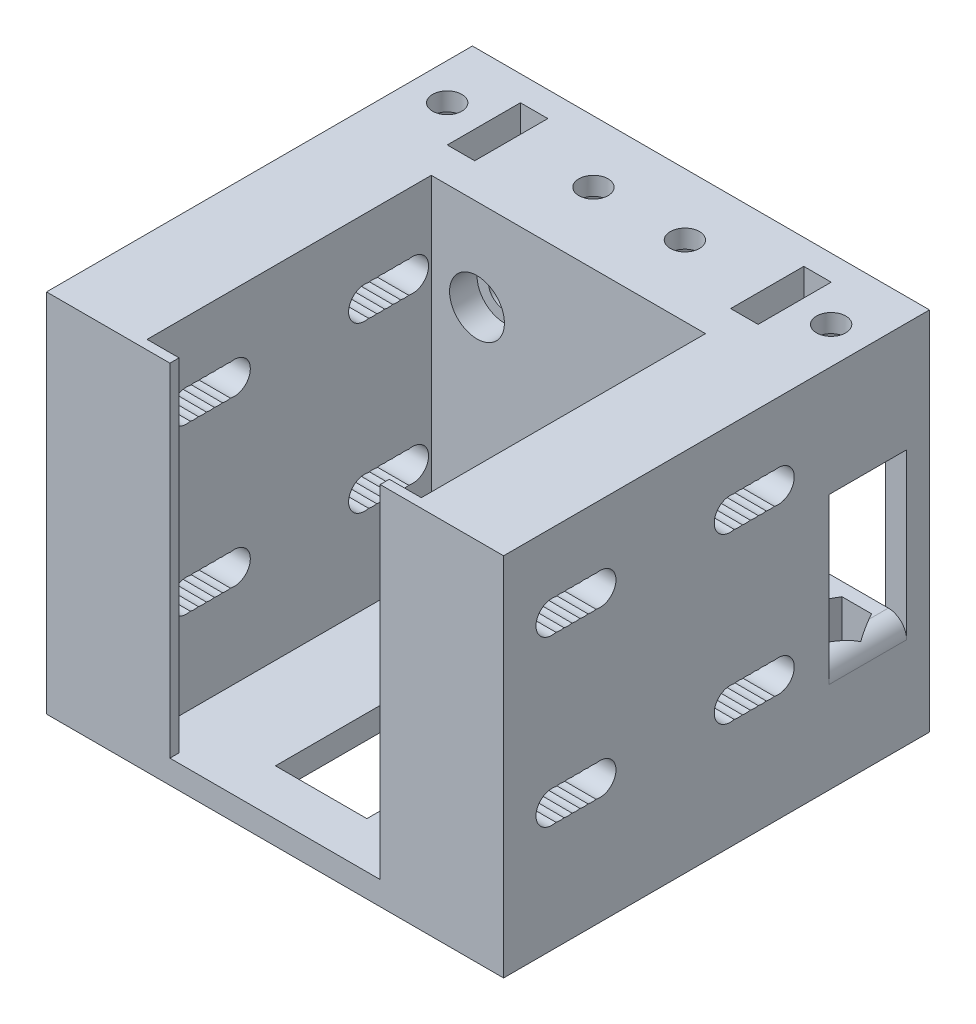
from build123d import *

# Parameters (mm, degrees)
SKETCH1_W                    = 50
SKETCH1_H                    = 15
MAIN_BODY_DEPTH              = 40
SKETCH2_W                    = 50
SKETCH2_H                    = 40
SKETCH2_W_2                  = 45.4
SKETCH2_H_2                  = 27.4
CARRAIGE_MOUNT_DEPTH         = 2.5
SKETCH3_R                    = 1.75
CARRAIGE_SCREW_HOLES_DEPTH   = 15
LA_CUTOUT_DEPTH              = 28.09
FRONT_WALL_DEPTH             = 1
SKETCH9_W                    = 10
SKETCH9_H                    = 20
LA_THROUGH_HOLE_DEPTH        = 3
SKETCH10_W                   = 8.5
SKETCH10_H                   = 16
BELT_HOLE_DEPTH              = 50
SKETCH14_R                   = 3
CARRAIGE_SCREW_HEADS_DEPTH   = 6
SKETCH15_W                   = 3
SKETCH15_H                   = 8
LEFT_BELT_SLOT_DEPTH         = 14
SKETCH19_R                   = 1.6
BELT_MOUNT_SCREW_HOLES_DEPTH = 14
BELT_MOUNT_NUT_HOLES_START   = -10
BELT_MOUNT_NUT_HOLES_DEPTH   = 40
FILLET1_R                    = 2
LA_SCREW_HOLES_START         = -10
SKETCH8_R                    = 1.75
LA_SCREW_HOLES_DEPTH         = 50
SKETCH21_W                   = 30
SKETCH21_H                   = 37.423299635
CUT_EXTRUDE1_DEPTH           = 3
LPATTERN1_COUNT              = 7
LPATTERN1_PITCH              = 0.875


with BuildPart() as part:
    # Sketch1 → Main_Body (new body)
    with BuildSketch(Plane(origin=(0, 0, 0), x_dir=(1, 0, 0), z_dir=(0, 1, 0))):
        with Locations((25, 7.5)):
            Rectangle(SKETCH1_W, SKETCH1_H)
    extrude(amount=MAIN_BODY_DEPTH)

    # Sketch2 → Carraige_Mount (add)
    with BuildSketch(Plane(origin=(0, 0, -15), x_dir=(-1, 0, 0), z_dir=(0, 0, -1))):
        with Locations((-25, 20)):
            Rectangle(SKETCH2_W, SKETCH2_H)
        with Locations((-25, 20)):
            Rectangle(SKETCH2_W_2, SKETCH2_H_2, mode=Mode.SUBTRACT)
    extrude(amount=CARRAIGE_MOUNT_DEPTH)

    # Sketch3 → Carraige_Screw_Holes (cut)
    with BuildSketch(Plane.XY):
        with Locations((15, 30)):
            Circle(SKETCH3_R)
        with Locations((35, 30)):
            Circle(SKETCH3_R)
        with Locations((35, 10)):
            Circle(SKETCH3_R)
        with Locations((15, 10)):
            Circle(SKETCH3_R)
    extrude(amount=-CARRAIGE_SCREW_HOLES_DEPTH, mode=Mode.SUBTRACT)

    # Sketch6 → LA_Cutout (add)
    with BuildSketch(Plane.XY):
        Polygon((0, 40), (0, 0), (50, 0), (50, 40), (40, 40), (40, 2.576700365), (10, 2.576700365), (10, 40), align=None)
    extrude(amount=LA_CUTOUT_DEPTH)

    # Sketch7 → Front_Wall (add)
    with BuildSketch(Plane.XY.offset(28.09)):
        Polygon((0, 40), (0, 0), (50, 0), (50, 40), (36.5, 40), (36.5, 2.576700365), (13.5, 2.576700365), (13.5, 40), align=None)
    extrude(amount=FRONT_WALL_DEPTH)

    # Sketch9 → LA_Through_Hole (cut)
    with BuildSketch(Plane(origin=(0, 2.576700365, 0), x_dir=(1, 0, 0), z_dir=(0, 1, 0))):
        with Locations((25, -14.045)):
            Rectangle(SKETCH9_W, SKETCH9_H)
    extrude(amount=-LA_THROUGH_HOLE_DEPTH, mode=Mode.SUBTRACT)

    # Sketch10 → Belt_Hole (cut)
    with BuildSketch(Plane.ZY):
        with Locations((-10.75, 20)):
            Rectangle(SKETCH10_W, SKETCH10_H)
    extrude(amount=-BELT_HOLE_DEPTH, mode=Mode.SUBTRACT)

    # Sketch14 → Carraige_Screw_Heads (cut)
    with BuildSketch(Plane.XY):
        with Locations((15, 30)):
            Circle(SKETCH14_R)
        with Locations((35, 30)):
            Circle(SKETCH14_R)
        with Locations((35, 10)):
            Circle(SKETCH14_R)
        with Locations((15, 10)):
            Circle(SKETCH14_R)
    extrude(amount=-CARRAIGE_SCREW_HEADS_DEPTH, mode=Mode.SUBTRACT)

    # Sketch15 → Left_Belt_Slot (cut)
    with BuildSketch(Plane(origin=(0, 40, 0), x_dir=(1, 0, 0), z_dir=(0, 1, 0))):
        with Locations((9.5, 10.75)):
            Rectangle(SKETCH15_W, SKETCH15_H)
    left_belt_slot = extrude(amount=-LEFT_BELT_SLOT_DEPTH, mode=Mode.SUBTRACT)

    # Sketch19 → Belt_Mount_Screw_Holes (cut)
    with BuildSketch(Plane(origin=(0, 40, 0), x_dir=(1, 0, 0), z_dir=(0, 1, 0))):
        with Locations(Location((4, 10.742261619, 0), (0, 0, 270))):
            Circle(SKETCH19_R)
        with Locations(Location((20, 10.742261619, 0), (0, 0, 270))):
            Circle(SKETCH19_R)
    belt_mount_screw_holes = extrude(amount=-BELT_MOUNT_SCREW_HOLES_DEPTH, mode=Mode.SUBTRACT)

    # Sketch20 → Belt_Mount_Nut_Holes (cut)
    with BuildSketch(Plane.XZ.offset(-28).offset(BELT_MOUNT_NUT_HOLES_START)):
        Polygon((18.383419246, -13.542261619), (21.616580754, -13.542261619), (23.233161507, -10.742261619), (21.616580754, -7.942261619), (18.383419246, -7.942261619), (16.766838493, -10.742261619), align=None)
        Polygon((7.233161507, -10.742261619), (5.616580754, -7.942261619), (2.383419246, -7.942261619), (0.766838493, -10.742261619), (2.383419246, -13.542261619), (5.616580754, -13.542261619), align=None)
    belt_mount_nut_holes = extrude(amount=BELT_MOUNT_NUT_HOLES_DEPTH, mode=Mode.SUBTRACT)

    # Belt_Mount_Mirror: Left_Belt_Slot, Belt_Mount_Screw_Holes, Belt_Mount_Nut_Holes across plane
    add(left_belt_slot.mirror(Plane.ZY.offset(-25)), mode=Mode.SUBTRACT)
    add(belt_mount_screw_holes.mirror(Plane.ZY.offset(-25)), mode=Mode.SUBTRACT)
    add(belt_mount_nut_holes.mirror(Plane.ZY.offset(-25)), mode=Mode.SUBTRACT)

    # Fillet1
    # the kernel refuses this fillet: 2 mm, written as the material it takes off along each edge
    with BuildSketch(Plane(origin=(50, 12, -15), x_dir=(0, -1, 0), z_dir=(0, 0, 1))) as fillet1_piece_1:
        with BuildLine():
            CenterArc((FILLET1_R, -FILLET1_R), FILLET1_R, 90, 90)
            Line((0, -FILLET1_R), (0, 0))
            Line((0, 0), (FILLET1_R, 0))
        make_face()
    extrude(amount=8.5, mode=Mode.SUBTRACT)
    with BuildSketch(Plane(origin=(0, 12, -15), x_dir=(0, -1, 0), z_dir=(0, 0, 1))) as fillet1_piece_2:
        with BuildLine():
            CenterArc((FILLET1_R, FILLET1_R), FILLET1_R, 180, 90)
            Line((0, FILLET1_R), (0, 0))
            Line((0, 0), (FILLET1_R, 0))
        make_face()
    extrude(amount=8.5, mode=Mode.SUBTRACT)

    # Sketch8 → LA_Screw_Holes (cut)
    with BuildSketch(Plane.ZY.offset(-40).offset(LA_SCREW_HOLES_START)):
        with Locations((4.295, 31.576700365)):
            Circle(SKETCH8_R)
        with Locations((23.795, 31.576700365)):
            Circle(SKETCH8_R)
        with Locations((4.295, 13.576700365)):
            Circle(SKETCH8_R)
        with Locations((23.795, 13.576700365)):
            Circle(SKETCH8_R)
    la_screw_holes = extrude(amount=LA_SCREW_HOLES_DEPTH, mode=Mode.SUBTRACT)

    # Sketch21 → Cut-Extrude1 (cut)
    with BuildSketch(Plane.XY):
        with Locations((25, 21.288350183)):
            Rectangle(SKETCH21_W, SKETCH21_H)
    extrude(amount=-CUT_EXTRUDE1_DEPTH, mode=Mode.SUBTRACT)

    # LPattern1: LA_Screw_Holes ×7
    with Locations(*[(0, 0, -i * LPATTERN1_PITCH) for i in range(1, LPATTERN1_COUNT)]):
        add(la_screw_holes, mode=Mode.SUBTRACT)


solid = part.part
